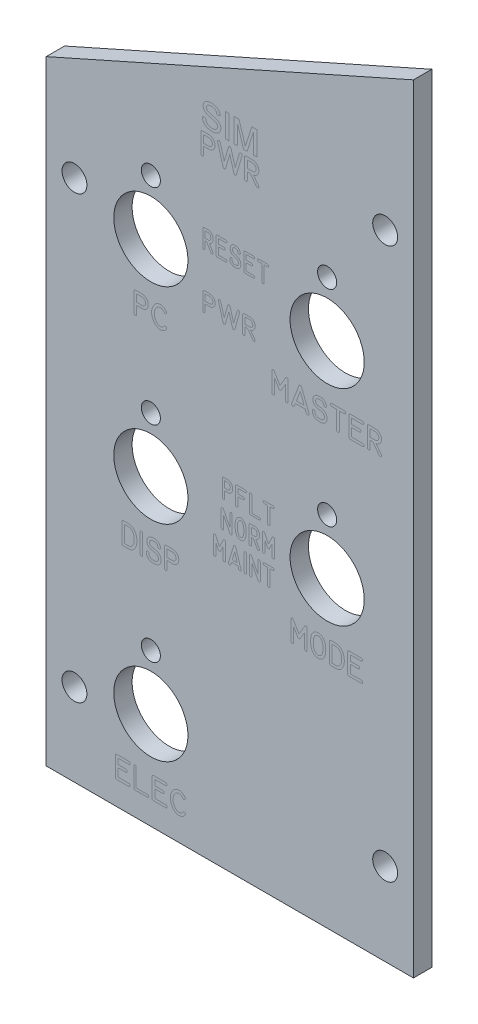
from build123d import *

# Parameters (mm, degrees)
BOSS_EXTRUDE1_DEPTH   = 3.175
SKETCH2_R             = 6.4135
SKETCH2_R_2           = 1.651
CUT_EXTRUDE1_DEPTH    = 151.327221464
F_6_CLEARANCE_HOLE1_D = 4.3053
CUT_EXTRUDE2_DEPTH    = 151.327221464


with BuildPart() as part:
    # Sketch1 → Boss-Extrude1 (new body)
    with BuildSketch(Plane.XY):
        Polygon((0, 107.95), (0, 0), (63.5, 0), (63.5, 136.2202), align=None)
    extrude(amount=-BOSS_EXTRUDE1_DEPTH)

    # Sketch2 → Cut-Extrude1 (cut, through all)
    with BuildSketch(Plane.XY):
        with Locations((18.0975, 16.8275)):
            Circle(SKETCH2_R)
        with Locations((18.0975, 26.3525)):
            Circle(SKETCH2_R_2)
        with Locations((48.5775, 52.3875)):
            Circle(SKETCH2_R)
        with Locations((48.5775, 61.9125)):
            Circle(SKETCH2_R_2)
        with Locations((48.5775, 87.9475)):
            Circle(SKETCH2_R)
        with Locations((48.5775, 97.4725)):
            Circle(SKETCH2_R_2)
        with Locations((18.0975, 97.4725)):
            Circle(SKETCH2_R_2)
        with Locations((18.0975, 87.9475)):
            Circle(SKETCH2_R)
        with Locations((18.0975, 61.9125)):
            Circle(SKETCH2_R_2)
        with Locations((18.0975, 52.3875)):
            Circle(SKETCH2_R)
    extrude(amount=-CUT_EXTRUDE1_DEPTH, mode=Mode.SUBTRACT)

    # #6 Clearance Hole1 (through all)
    with Locations(Plane.XY):
        with Locations((58.6105, 14.2875), (4.8895, 14.2875), (4.8895, 90.4875), (58.6105, 109.5375)):
            Hole(F_6_CLEARANCE_HOLE1_D / 2)

    # Sketch6 → Cut-Extrude2 (cut, through all)
    with BuildSketch(Plane.XY):
        Polygon((63.5, 136.2202), (0, 107.95), (0, 106.212283429), (63.5, 134.482483429), align=None)
    extrude(amount=-CUT_EXTRUDE2_DEPTH, mode=Mode.SUBTRACT)


solid = part.part
